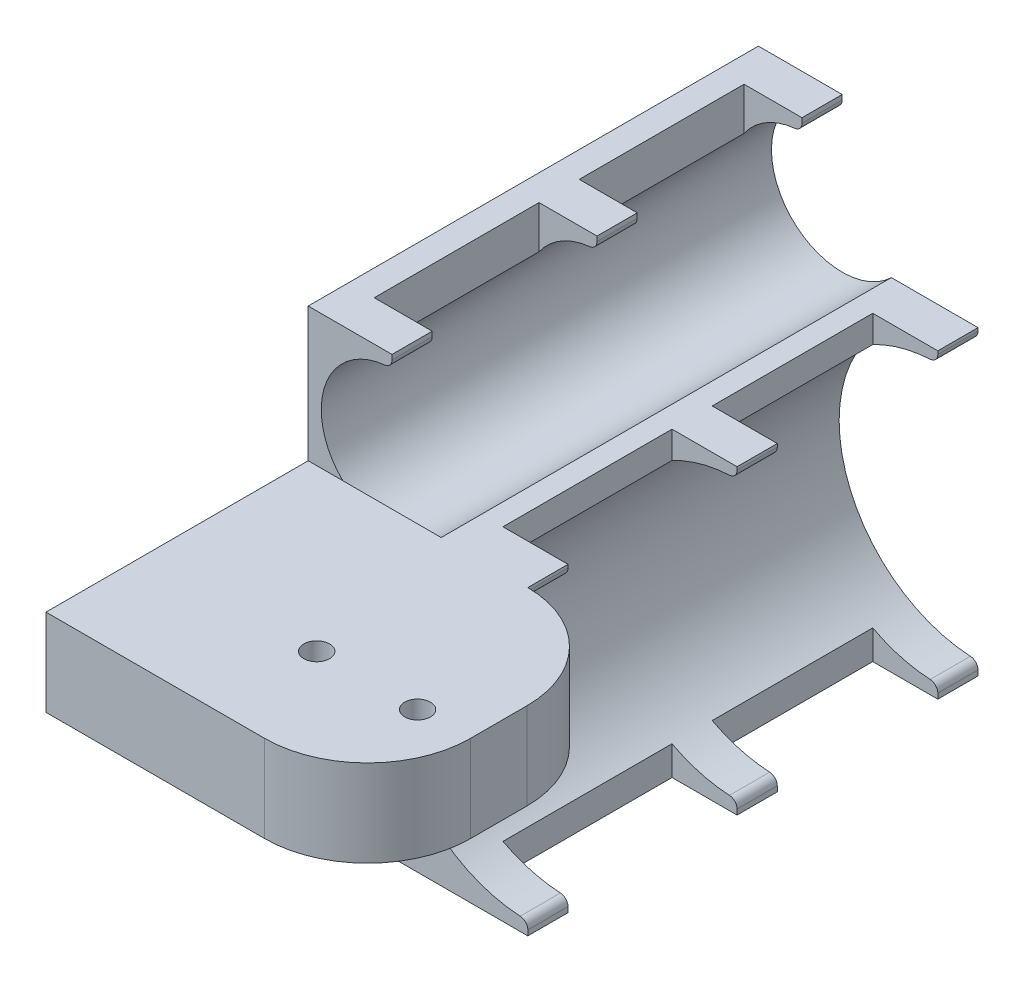
from build123d import *

# Parameters (mm, degrees)
BOSS_EXTRUDE1_DEPTH = 70
SKETCH2_W           = 30.127897987
SKETCH2_H           = 25.625
CUT_EXTRUDE1_DEPTH  = 10
SKETCH3_W           = 36.135462637
SKETCH3_H           = 24.960917338
SKETCH3_H_2         = 26.289082662
CUT_EXTRUDE2_DEPTH  = 88.210896549
SKETCH5_W           = 40.769231001
SKETCH5_H           = 13.5
BOSS_EXTRUDE2_DEPTH = 50
SKETCH6_R           = 2
CUT_EXTRUDE3_DEPTH  = 50
FILLET1_R           = 1.25
FILLET2_R           = 16


with BuildPart() as part:
    # Sketch1 → Boss-Extrude1 (new body)
    with BuildSketch(Plane.XY):
        with BuildLine():
            Line((22.473811518, 84.75800041), (22.473811518, 83.058719541))
            ThreePointArc((22.473811518, 83.058719541), (0.883811518, 61.468719541), (22.473811518, 39.878719541))
            Line((22.473811518, 39.878719541), (22.473811518, 37.846719541))
            Line((22.473811518, 37.846719541), (-11.673355367, 37.846719541))
            Line((-11.673355367, 37.846719541), (-11.673355367, 105.594024014))
            Line((-11.673355367, 105.594024014), (1.358644633, 105.594024014))
            Line((1.358644633, 105.594024014), (1.358644633, 103.665116534))
            ThreePointArc((1.358644633, 103.665116534), (-8.83886186, 88.540693991), (9.005703845, 84.75800041))
            Line((9.005703845, 84.75800041), (22.473811518, 84.75800041))
        make_face()
    extrude(amount=-BOSS_EXTRUDE1_DEPTH)

    # Sketch2 → Cut-Extrude1 (cut)
    with BuildSketch(Plane(origin=(0, 105.594024014, 0), x_dir=(1, 0, 0), z_dir=(0, 1, 0))):
        with Locations((7.409862525, 50.9375)):
            Rectangle(SKETCH2_W, SKETCH2_H)
        with Locations((7.409862525, 19.0625)):
            Rectangle(SKETCH2_W, SKETCH2_H)
    extrude(amount=-CUT_EXTRUDE1_DEPTH, mode=Mode.SUBTRACT)

    # Sketch3 → Cut-Extrude2 (cut, through all)
    with BuildSketch(Plane(origin=(0, 84.75800041, 0), x_dir=(1, 0, 0), z_dir=(0, 1, 0))):
        with Locations((30.426375951, 51.269541331)):
            Rectangle(SKETCH3_W, SKETCH3_H)
        with Locations((30.426375951, 19.394541331)):
            Rectangle(SKETCH3_W, SKETCH3_H_2)
    extrude(amount=-CUT_EXTRUDE2_DEPTH, mode=Mode.SUBTRACT)

    # Sketch5 → Boss-Extrude2 (add)
    with BuildSketch(Plane.ZY.offset(11.673355367)):
        with Locations((20.384615501, 78.00800041)):
            Rectangle(SKETCH5_W, SKETCH5_H)
    extrude(amount=-BOSS_EXTRUDE2_DEPTH)

    # Sketch6 → Cut-Extrude3 (cut)
    with BuildSketch(Plane(origin=(0, 84.75800041, 0), x_dir=(1, 0, 0), z_dir=(0, 1, 0))):
        with Locations((14.647627353, -25)):
            Circle(SKETCH6_R)
        with Locations((30.329421103, -25)):
            Circle(SKETCH6_R)
    extrude(amount=-CUT_EXTRUDE3_DEPTH, mode=Mode.SUBTRACT)

    # Fillet1
    fillet1_edges = [part.edges().sort_by_distance(p)[0] for p in [
        (22.473811518, 39.878719541, -66.875),
        (22.473811518, 39.878719541, -35.664082662),
        (22.473811518, 39.878719541, -3.125),
        (22.473811518, 83.058719541, -3.125),
        (22.473811518, 83.058719541, -35.664082662),
        (22.473811518, 83.058719541, -66.875),
        (1.358644633, 103.665116534, -66.875),
        (1.358644633, 103.665116534, -35),
        (1.358644633, 103.665116534, -3.125),
    ]]
    fillet(fillet1_edges, radius=FILLET1_R)

    # Fillet2
    fillet2_edges = [part.edges().sort_by_distance(p)[0] for p in [
        (38.326644633, 78.00800041, 0),
        (38.326644633, 78.00800041, 40.769231001),
    ]]
    fillet(fillet2_edges, radius=FILLET2_R)


solid = part.part
